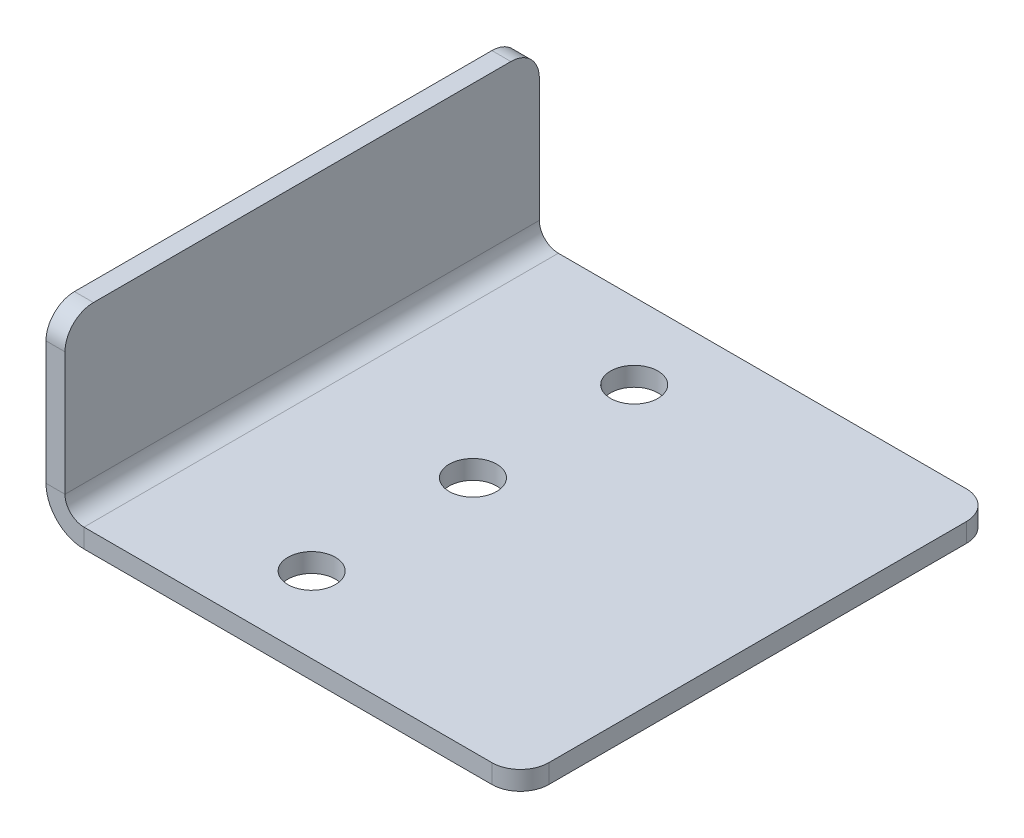
from build123d import *

# Parameters (mm, degrees)
SKETCH1_W                    = 50
SKETCH1_H                    = 50
BASE_FLANGE1_DEPTH           = 2
EDGE_FLANGE1_STRIP_W         = 12
EDGE_FLANGE1_STRIP_H         = 2
EDGE_FLANGE1_STRIP_CUT_DEPTH = 50
EDGE_FLANGE1_DEPTH           = 50
F_5_0MM_DOWEL_HOLE1_D        = 5
FILLET1_R                    = 3


# Sheet-metal steps are written as plain solids
with BuildPart() as part:
    # Sketch1 → Base-Flange1 (new body)
    with BuildSketch(Plane(origin=(0, 0, 0), x_dir=(1, 0, 0), z_dir=(0, 1, 0))):
        Rectangle(SKETCH1_W, SKETCH1_H)
    extrude(amount=BASE_FLANGE1_DEPTH)

    # Edge-Flange1 strip (across the edge) → Edge-Flange1 strip cut (cut)
    with BuildSketch(Plane(origin=(-25, 2, -25), x_dir=(1, 0, 0), z_dir=(0, 0, 1))):
        with Locations((-2, -1)):
            Rectangle(EDGE_FLANGE1_STRIP_W, EDGE_FLANGE1_STRIP_H)
    extrude(amount=EDGE_FLANGE1_STRIP_CUT_DEPTH, mode=Mode.SUBTRACT)

    # Edge-Flange1 section (across the edge) → Edge-Flange1 (add)
    with BuildSketch(Plane(origin=(-25, 2, -25), x_dir=(1, 0, 0), z_dir=(0, 0, 1))):
        with BuildLine():
            Line((0, 2), (0, 18))
            Line((0, 18), (2, 18))
            Line((2, 18), (2, 2))
            ThreePointArc((2, 2), (2.585786438, 0.585786438), (4, 0))
            Line((4, 0), (4, -2))
            ThreePointArc((4, -2), (1.171572875, -0.828427125), (0, 2))
        make_face()
    extrude(amount=EDGE_FLANGE1_DEPTH)

    # Ø5.0mm Dowel Hole1 (through all)
    with Locations(Plane(origin=(0, 2, 0), x_dir=(1, 0, 0), z_dir=(0, 1, 0))):
        with Locations((-5, 17), (-5, 0), (-5, -17)):
            Hole(F_5_0MM_DOWEL_HOLE1_D / 2)

    # Fillet1
    fillet1_edges = [part.edges().sort_by_distance(p)[0] for p in [
        (-24, 20, -25),
        (-24, 20, 25),
        (25, 1, -25),
        (25, 1, 25),
    ]]
    fillet(fillet1_edges, radius=FILLET1_R)


solid = part.part
